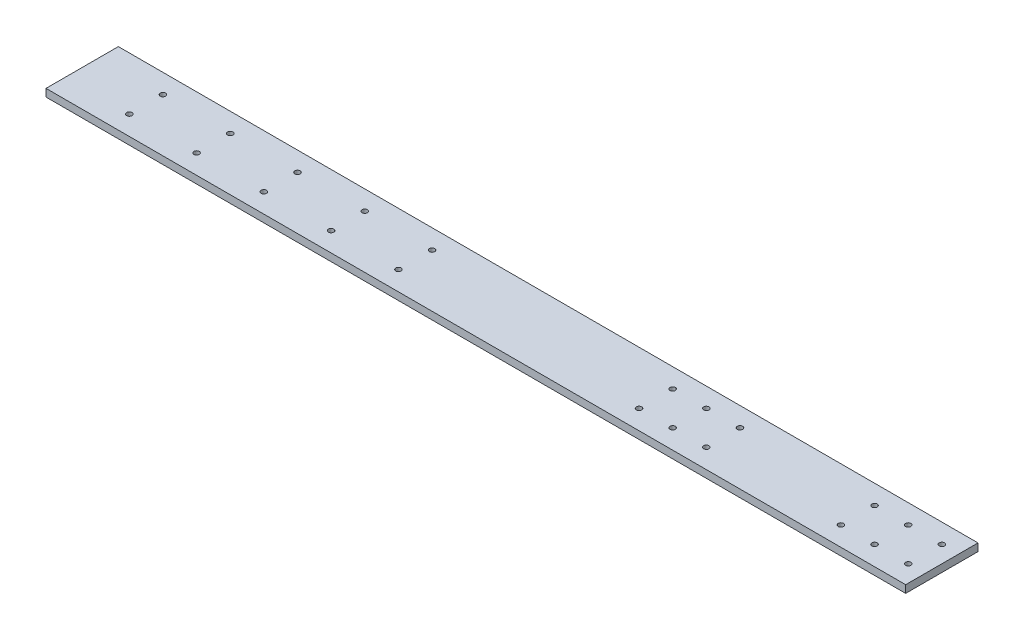
from build123d import *

# Parameters (mm, degrees)
SKETCH1_W           = 511
SKETCH1_H           = 43
SKETCH1_R           = 1.6
BOSS_EXTRUDE1_DEPTH = 4.5


with BuildPart() as part:
    # Sketch1 → Boss-Extrude1 (new body)
    with BuildSketch(Plane(origin=(0, 0, 0), x_dir=(1, 0, 0), z_dir=(0, 1, 0))):
        Rectangle(SKETCH1_W, SKETCH1_H)
        with Locations((-217.5, 10)):
            Circle(SKETCH1_R, mode=Mode.SUBTRACT)
        with Locations((-177.5, 10)):
            Circle(SKETCH1_R, mode=Mode.SUBTRACT)
        with Locations((-137.5, 10)):
            Circle(SKETCH1_R, mode=Mode.SUBTRACT)
        with Locations((-97.5, 10)):
            Circle(SKETCH1_R, mode=Mode.SUBTRACT)
        with Locations((-57.5, 10)):
            Circle(SKETCH1_R, mode=Mode.SUBTRACT)
        with Locations((-177.5, -10)):
            Circle(SKETCH1_R, mode=Mode.SUBTRACT)
        with Locations((-137.5, -10)):
            Circle(SKETCH1_R, mode=Mode.SUBTRACT)
        with Locations((-97.5, -10)):
            Circle(SKETCH1_R, mode=Mode.SUBTRACT)
        with Locations((-57.5, -10)):
            Circle(SKETCH1_R, mode=Mode.SUBTRACT)
        with Locations((-217.5, -10)):
            Circle(SKETCH1_R, mode=Mode.SUBTRACT)
        with Locations((225.5, 10)):
            Circle(SKETCH1_R, mode=Mode.SUBTRACT)
        with Locations((105.5, 10)):
            Circle(SKETCH1_R, mode=Mode.SUBTRACT)
        with Locations((105.5, -10)):
            Circle(SKETCH1_R, mode=Mode.SUBTRACT)
        with Locations((225.5, -10)):
            Circle(SKETCH1_R, mode=Mode.SUBTRACT)
        with Locations((125.5, -10)):
            Circle(SKETCH1_R, mode=Mode.SUBTRACT)
        with Locations((125.5, 10)):
            Circle(SKETCH1_R, mode=Mode.SUBTRACT)
        with Locations((245.5, 10)):
            Circle(SKETCH1_R, mode=Mode.SUBTRACT)
        with Locations((245.5, -10)):
            Circle(SKETCH1_R, mode=Mode.SUBTRACT)
        with Locations((85.5, -10)):
            Circle(SKETCH1_R, mode=Mode.SUBTRACT)
        with Locations((85.5, 10)):
            Circle(SKETCH1_R, mode=Mode.SUBTRACT)
        with Locations((205.5, 10)):
            Circle(SKETCH1_R, mode=Mode.SUBTRACT)
        with Locations((205.5, -10)):
            Circle(SKETCH1_R, mode=Mode.SUBTRACT)
    extrude(amount=BOSS_EXTRUDE1_DEPTH)


solid = part.part
